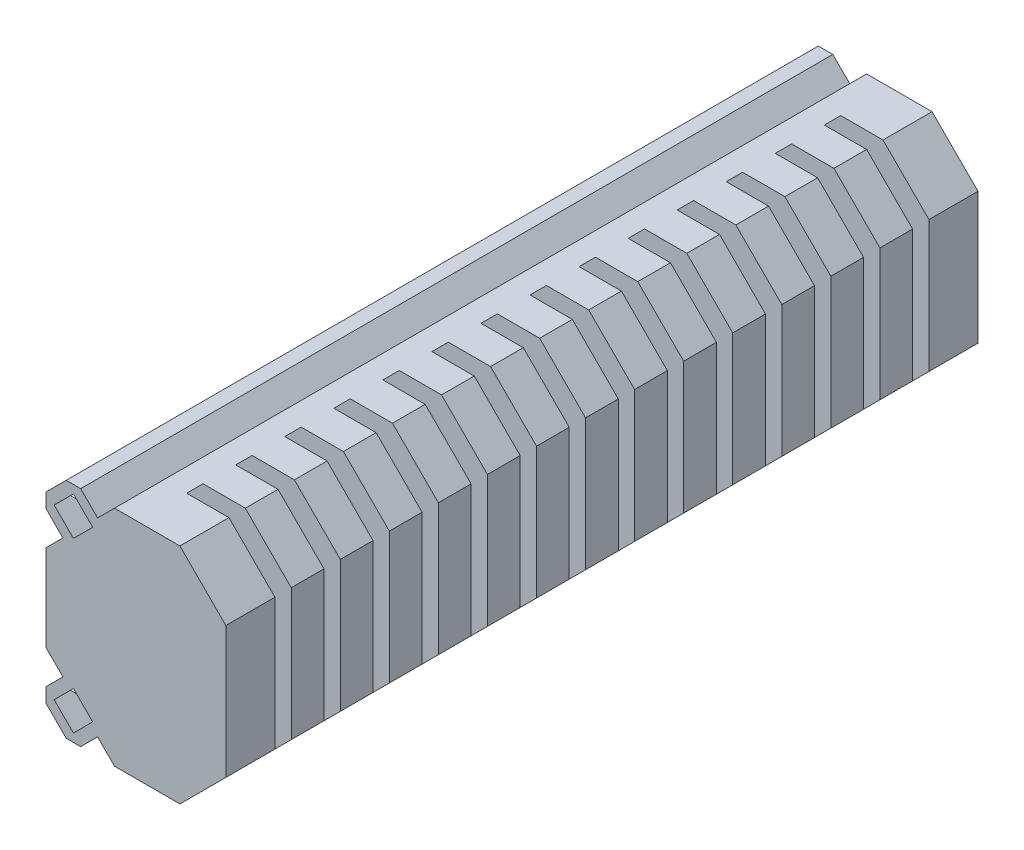
from build123d import *

# Parameters (mm, degrees)
AUFSATZ_LINEAR_AUSTRAGEN2_DEPTH      = 1.2
SCHNITT_LINEAR_AUSTRAGEN1_DEPTH      = 0.4
SCHNITT_LINEAR_AUSTRAGEN2_DEPTH      = 12.658473313
AUFSATZ_LINEAR_AUSTRAGEN3_DEPTH      = 1.2
SCHNITT_LINEAR_AUSTRAGEN3_DEPTH      = 13.142487389
LINEARES_MUSTER1_COUNT               = 15
LINEARES_MUSTER1_PITCH               = 3.6
AUFSATZ_LINEAR_AUSTRAGEN4_DEPTH      = 1.2
AUFSATZ_LINEAR_AUSTRAGEN4_DEPTH_BACK = 0.8
AUFSATZ_LINEAR_AUSTRAGEN5_DEPTH      = 1.2
AUFSATZ_LINEAR_AUSTRAGEN5_DEPTH_BACK = 0.8
AUFSATZ_LINEAR_AUSTRAGEN6_DEPTH      = 55.2
SCHNITT_LINEAR_AUSTRAGEN5_DEPTH      = 57.404964321
SCHNITT_LINEAR_AUSTRAGEN4_REACH      = 57.039


with BuildPart() as part:
    # Skizze3 → Aufsatz-Linear austragen2 (new, symmetric)
    with BuildSketch(Plane.XY):
        Polygon((-8.2, -3.171572875), (-8.2, 3.171572875), (-3.171572875, 8.2), (1.628427125, 8.2), (5, 4.828427125), (5, -4.828427125), (1.628427125, -8.2), (-3.171572875, -8.2), align=None)
    aufsatz_linear_austragen2 = extrude(amount=AUFSATZ_LINEAR_AUSTRAGEN2_DEPTH, both=True)

    # Skizze2 → Schnitt-Linear austragen1 (cut, symmetric)
    with BuildSketch(Plane.XY):
        Polygon((-7, 0), (0, 7), (3, 4), (3, -4), (0, -7), align=None)
    schnitt_linear_austragen1 = extrude(amount=SCHNITT_LINEAR_AUSTRAGEN1_DEPTH, both=True, mode=Mode.SUBTRACT)

    # Skizze5 → Schnitt-Linear austragen2 (cut, symmetric)
    with BuildSketch(Plane.XY):
        Polygon((-7, 0), (-6.151471863, 0.848528137), (-5.302943725, 0), (-6.151471863, -0.848528137), align=None)
    schnitt_linear_austragen2 = extrude(amount=SCHNITT_LINEAR_AUSTRAGEN2_DEPTH, both=True, mode=Mode.SUBTRACT)

    # Skizze6 → Aufsatz-Linear austragen3 (add)
    with BuildSketch(Plane.XY.offset(1.2)):
        Polygon((-1.4745166, 8.2), (-3.171572875, 8.2), (-8.2, 3.171572875), (-8.2, -3.171572875), (-3.171572875, -8.2), (-1.4745166, -8.2), (-4.502943725, -5.171572875), (-4.502943725, 5.171572875), align=None)
    aufsatz_linear_austragen3 = extrude(amount=AUFSATZ_LINEAR_AUSTRAGEN3_DEPTH)

    # Skizze7 → Schnitt-Linear austragen3 (cut, through all)
    with BuildSketch(Plane(origin=(0, 0, -1.2), x_dir=(-1, 0, 0), z_dir=(0, 0, -1))):
        Polygon((6.151471863, -0.848528137), (7, 0), (6.151471863, 0.848528137), (5.302943725, 0), align=None)
    schnitt_linear_austragen3 = extrude(amount=-SCHNITT_LINEAR_AUSTRAGEN3_DEPTH, mode=Mode.SUBTRACT)

    # Lineares Muster1: Aufsatz-Linear austragen2, Schnitt-Linear austragen1, Schnitt-Linear austragen2, Aufsatz-Linear austragen3, Schnitt-Linear austragen3 ×15
    with Locations(*[(0, 0, i * LINEARES_MUSTER1_PITCH) for i in range(1, LINEARES_MUSTER1_COUNT)]):
        add(aufsatz_linear_austragen2)
        add(schnitt_linear_austragen1, mode=Mode.SUBTRACT)
        add(schnitt_linear_austragen2, mode=Mode.SUBTRACT)
        add(aufsatz_linear_austragen3)
        add(schnitt_linear_austragen3, mode=Mode.SUBTRACT)

    # Skizze8 → Aufsatz-Linear austragen4 (add, two sides: drawn at the far end of the back side and taken through both)
    with BuildSketch(Plane(origin=(0, 0, -1.2), x_dir=(-1, 0, 0), z_dir=(0, 0, -1)).offset(-AUFSATZ_LINEAR_AUSTRAGEN4_DEPTH_BACK)):
        Polygon((3.171572875, -8.2), (8.2, -3.171572875), (8.2, 3.171572875), (3.171572875, 8.2), (-1.628427125, 8.2), (-5, 4.828427125), (-5, -4.828427125), (-1.628427125, -8.2), align=None)
    extrude(amount=AUFSATZ_LINEAR_AUSTRAGEN4_DEPTH + AUFSATZ_LINEAR_AUSTRAGEN4_DEPTH_BACK)

    # Skizze9 → Aufsatz-Linear austragen5 (add, two sides: drawn at the far end of the back side and taken through both)
    with BuildSketch(Plane.XY.offset(51.6).offset(-AUFSATZ_LINEAR_AUSTRAGEN5_DEPTH_BACK)):
        Polygon((-1.4745166, 8.2), (-3.171572875, 8.2), (-8.2, 3.171572875), (-8.2, -3.171572875), (-3.171572875, -8.2), (-1.4745166, -8.2), (1.628427125, -8.2), (5, -4.828427125), (5, 4.828427125), (1.628427125, 8.2), align=None)
    extrude(amount=AUFSATZ_LINEAR_AUSTRAGEN5_DEPTH + AUFSATZ_LINEAR_AUSTRAGEN5_DEPTH_BACK)

    # Skizze10 → Aufsatz-Linear austragen6 (add)
    with BuildSketch(Plane(origin=(0, 0, -2.4), x_dir=(-1, 0, 0), z_dir=(0, 0, -1))):
        Polygon((6.185786438, -7.6), (7.6, -6.185786438), (6.392893219, -4.978679656), (6.958578644, -4.412994231), (8.2, -5.654415588), (8.2, -6.717157288), (6.717157288, -8.2), (5.654415588, -8.2), (4.412994231, -6.958578644), (4.978679656, -6.392893219), align=None)
    aufsatz_linear_austragen6 = extrude(amount=-AUFSATZ_LINEAR_AUSTRAGEN6_DEPTH)

    # Skizze12 → Schnitt-Linear austragen5 (cut, through all)
    with BuildSketch(Plane(origin=(0, 0, -2.4), x_dir=(-1, 0, 0), z_dir=(0, 0, -1))):
        Polygon((6.185786438, -7.6), (4.771572875, -6.185786438), (6.185786438, -4.771572875), (7.6, -6.185786438), align=None)
    schnitt_linear_austragen5 = extrude(amount=-SCHNITT_LINEAR_AUSTRAGEN5_DEPTH, mode=Mode.SUBTRACT)

    # Spiegeln1: Aufsatz-Linear austragen6, Schnitt-Linear austragen5 across plane
    add(aufsatz_linear_austragen6.mirror(Plane.ZX))
    add(schnitt_linear_austragen5.mirror(Plane.ZX), mode=Mode.SUBTRACT)

    # Skizze11 → Schnitt-Linear austragen4 (cut, up to next)
    with BuildSketch(Plane.ZY.offset(8.2), mode=Mode.PRIVATE) as schnitt_linear_austragen4_sk1:
        Polygon((-1.2, 6.185786438), (0.214213562, 7.6), (1.628427125, 6.185786438), (0.214213562, 4.771572875), align=None)
    schnitt_linear_austragen4_tool1 = extrude(schnitt_linear_austragen4_sk1.sketch, amount=-SCHNITT_LINEAR_AUSTRAGEN4_REACH, mode=Mode.PRIVATE) & part.part
    # Skizze11 → Schnitt-Linear austragen4 (cut, up to next)
    with BuildSketch(Plane.ZY.offset(8.2), mode=Mode.PRIVATE) as schnitt_linear_austragen4_sk2:
        Polygon((0.214213562, -4.771572875), (-1.2, -6.185786438), (0.214213562, -7.6), (1.628427125, -6.185786438), align=None)
    schnitt_linear_austragen4_tool2 = extrude(schnitt_linear_austragen4_sk2.sketch, amount=-SCHNITT_LINEAR_AUSTRAGEN4_REACH, mode=Mode.PRIVATE) & part.part
    # Skizze11 → Schnitt-Linear austragen4 (cut, up to next)
    with BuildSketch(Plane.ZY.offset(8.2), mode=Mode.PRIVATE) as schnitt_linear_austragen4_sk3:
        Polygon((48.771572875, -6.185786438), (50.185786438, -4.771572875), (51.6, -6.185786438), (50.185786438, -7.6), align=None)
    schnitt_linear_austragen4_tool3 = extrude(schnitt_linear_austragen4_sk3.sketch, amount=-SCHNITT_LINEAR_AUSTRAGEN4_REACH, mode=Mode.PRIVATE) & part.part
    # Skizze11 → Schnitt-Linear austragen4 (cut, up to next)
    with BuildSketch(Plane.ZY.offset(8.2), mode=Mode.PRIVATE) as schnitt_linear_austragen4_sk4:
        Polygon((50.185786438, 4.771572875), (51.6, 6.185786438), (50.185786438, 7.6), (48.771572875, 6.185786438), align=None)
    schnitt_linear_austragen4_tool4 = extrude(schnitt_linear_austragen4_sk4.sketch, amount=-SCHNITT_LINEAR_AUSTRAGEN4_REACH, mode=Mode.PRIVATE) & part.part
    add(schnitt_linear_austragen4_tool1.solids().sort_by_distance((-8.2, 6.185786, 0.214214))[0], mode=Mode.SUBTRACT)
    add(schnitt_linear_austragen4_tool2.solids().sort_by_distance((-8.2, -6.185786, 0.214214))[0], mode=Mode.SUBTRACT)
    add(schnitt_linear_austragen4_tool3.solids().sort_by_distance((-8.2, -6.185786, 50.185786))[0], mode=Mode.SUBTRACT)
    add(schnitt_linear_austragen4_tool4.solids().sort_by_distance((-8.2, 6.185786, 50.185786))[0], mode=Mode.SUBTRACT)


solid = part.part
